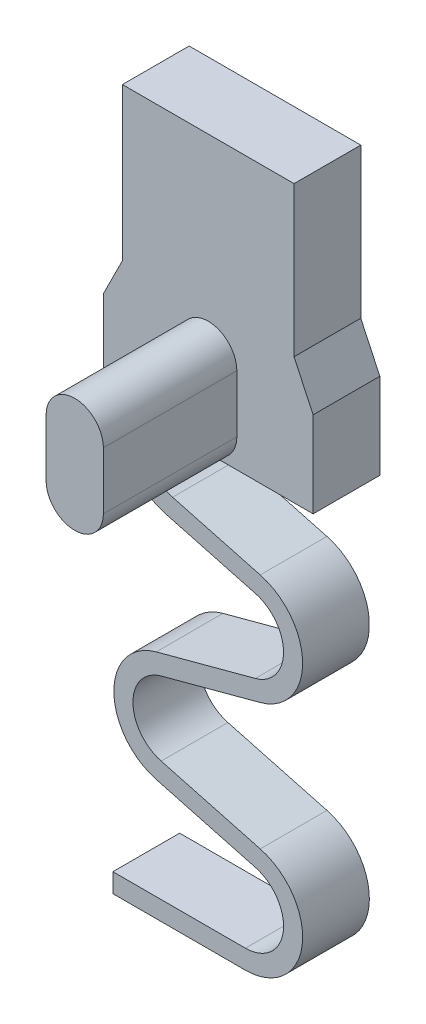
from build123d import *

# Parameters (mm, degrees)
EXTRUDE_THIN1_OUTLINE_W = 9
EXTRUDE_THIN1_OUTLINE_H = 12.5
EXTRUDE_THIN1_DEPTH     = 3.5
SKETCH1_3_W             = 10
SKETCH1_3_H             = 13.5
BOSS_EXTRUDE1_DEPTH     = 3.5
BOSS_EXTRUDE2_DEPTH     = 7
CUT_EXTRUDE1_DEPTH      = 39.801707437
CUT_EXTRUDE1_DEPTH_BACK = 39.801707437


# Read off the part's stored shape, not the designer's step: Extrude-Thin1
with BuildPart() as part:
    # Extrude-Thin1 outline → Extrude-Thin1 (new body)
    with BuildSketch(Plane.XY):
        with BuildLine():
            ThreePointArc((0.177562937, 22), (1.247898439, 19.536389911), (3.521526088, 18.106141657))
            Line((3.521526088, 18.106141657), (8.11763809, 16.874617158))
            ThreePointArc((8.11763809, 16.874617158), (9.6, 14.942765505), (8.11763809, 13.010913852))
            Line((8.11763809, 13.010913852), (2.923542865, 11.619160231))
            ThreePointArc((2.923542865, 11.619160231), (0.7, 8.721382753), (2.923542865, 5.823605274))
            Line((2.923542865, 5.823605274), (8.11763809, 4.431851653))
            ThreePointArc((8.11763809, 4.431851653), (9.582889723, 2.238947616), (7.6, 0.5))
            Line((7.6, 0.5), (0.65, 0.5))
            Line((0.65, 0.5), (0.65, -0.5))
            Line((0.65, -0.5), (7.6, -0.5))
            ThreePointArc((7.6, -0.5), (10.574334584, 2.108421424), (8.376457135, 5.397777479))
            Line((8.376457135, 5.397777479), (3.18236191, 6.7895311))
            ThreePointArc((3.18236191, 6.7895311), (1.7, 8.721382752), (3.18236191, 10.653234405))
            Line((3.18236191, 10.653234405), (8.376457135, 12.044988026))
            ThreePointArc((8.376457135, 12.044988026), (10.6, 14.942765505), (8.376457135, 17.840542984))
            Line((8.376457135, 17.840542984), (3.780345133, 19.072067483))
            ThreePointArc((3.780345133, 19.072067483), (2.042960507, 20.146152168), (1.185399159, 22))
            Line((1.185399159, 22), (11.15, 22))
            Line((11.15, 22), (11.15, 36.5))
            Line((11.15, 36.5), (0.15, 36.5))
            Line((0.15, 36.5), (0.15, 22))
            Line((0.15, 22), (0.177562937, 22))
        make_face()
        with Locations((5.65, 29.25)):
            Rectangle(EXTRUDE_THIN1_OUTLINE_W, EXTRUDE_THIN1_OUTLINE_H, mode=Mode.SUBTRACT)
    extrude(amount=EXTRUDE_THIN1_DEPTH)

    # Sketch1<3> → Boss-Extrude1 (add)
    with BuildSketch(Plane.XY):
        with Locations((5.65, 29.25)):
            Rectangle(SKETCH1_3_W, SKETCH1_3_H)
    extrude(amount=BOSS_EXTRUDE1_DEPTH)

    # Sketch2 → Boss-Extrude2 (add)
    with BuildSketch(Plane.XY.offset(3.5)):
        with BuildLine():
            Line((7.15, 26.5), (7.15, 23.5))
            ThreePointArc((7.15, 23.5), (5.65, 22), (4.15, 23.5))
            Line((4.15, 23.5), (4.15, 26.5))
            ThreePointArc((4.15, 26.5), (5.65, 28), (7.15, 26.5))
        make_face()
    extrude(amount=BOSS_EXTRUDE2_DEPTH)

    # Sketch3 → Cut-Extrude1 (cut, two sides: drawn at the far end of the back side and taken through both)
    with BuildSketch(Plane.XY.offset(3.5).offset(-CUT_EXTRUDE1_DEPTH_BACK)):
        Polygon((0.15, 26.5), (1.15, 28.5), (1.15, 36.7), (10.15, 36.7), (10.15, 28.636121044), (11.15, 26.5), (15.293937853, 34.999866887), (13.289839187, 39.280864223), (-0.624731021, 39.280864223), (-5.238216118, 36.366540163), align=None)
    extrude(amount=CUT_EXTRUDE1_DEPTH + CUT_EXTRUDE1_DEPTH_BACK, mode=Mode.SUBTRACT)


solid = part.part
